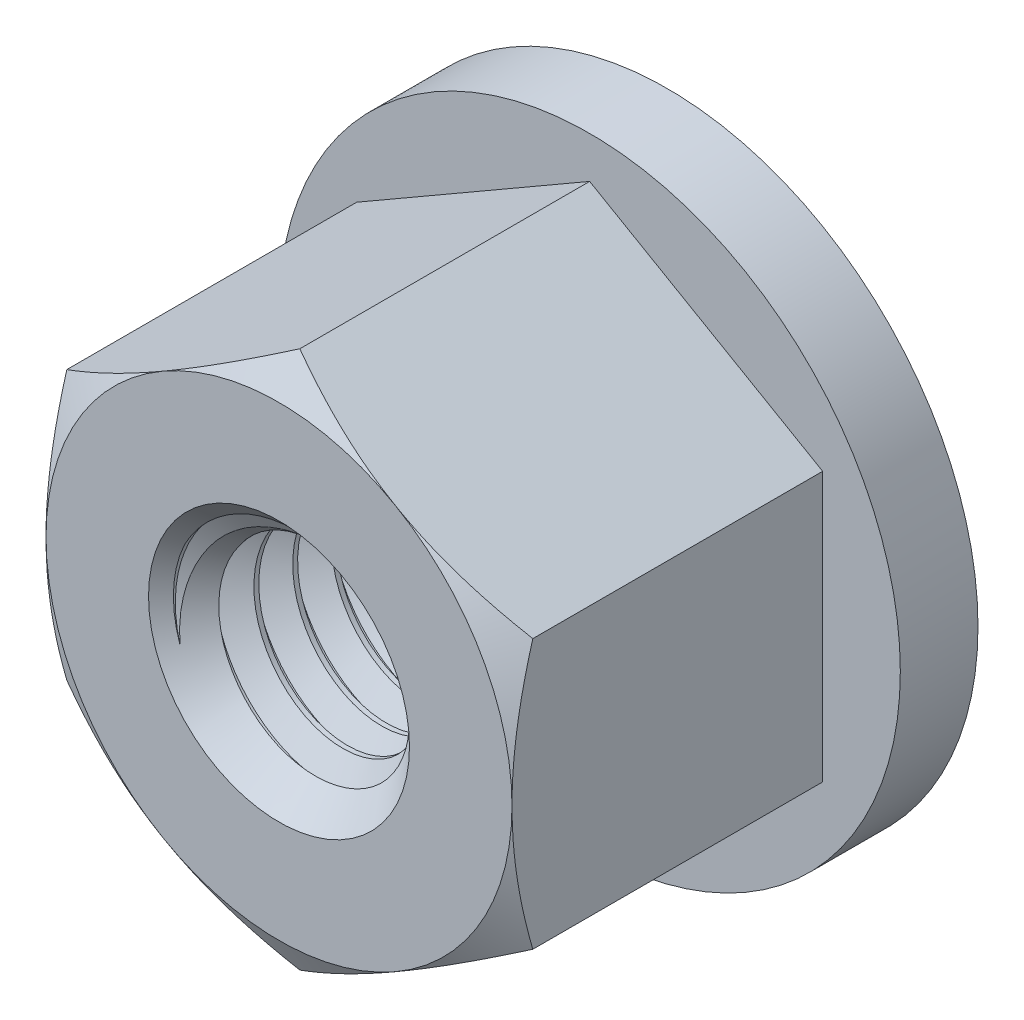
from build123d import *

# Parameters (mm, degrees)
EXTRUDE1_DEPTH     = 7.9375
SKETCH13_R         = 6.35
EXTRUDE3_DEPTH     = 1.5875
SKETCH2_OUTSIDE_W  = 63.61
SKETCH2_OUTSIDE_H  = 63.61
SKETCH2_OUTSIDE_R  = 4.7625
CUT_EXTRUDE1_DEPTH = 12.985362166
CUT_EXTRUDE1_DRAFT = -60
SKETCH4_R          = 2.413
CUT_EXTRUDE3_DEPTH = 12.985362166
SKETCH12_R         = 2.413
SKETCH12_R_2       = 1.897444252
EXTRUDE2_DEPTH     = 7.9375
CUT_SWEEP1_PITCH   = 0.79375


with BuildPart() as part:
    # Sketch1 → Extrude1 (new body)
    with BuildSketch(Plane.XY):
        Polygon((0, 5.499261314), (-4.7625, 2.749630657), (-4.7625, -2.749630657), (0, -5.499261314), (4.7625, -2.749630657), (4.7625, 2.749630657), align=None)
    extrude(amount=-EXTRUDE1_DEPTH)

    # Sketch13 → Extrude3 (add)
    with BuildSketch(Plane(origin=(0, 0, -7.9375), x_dir=(-1, 0, 0), z_dir=(0, 0, -1))):
        Circle(SKETCH13_R)
    extrude(amount=-EXTRUDE3_DEPTH)


with BuildPart() as cut_extrude1_tool:
    # Sketch2 outside → Cut-Extrude1 (with draft: the straight prism first)
    with BuildSketch(Plane.XY):
        Rectangle(SKETCH2_OUTSIDE_W, SKETCH2_OUTSIDE_H)
        Circle(SKETCH2_OUTSIDE_R, mode=Mode.SUBTRACT)
    extrude(amount=-CUT_EXTRUDE1_DEPTH)
    # Cut-Extrude1: the draft: its side faces are tilted about the plane it starts from
    cut_extrude1_sides = [cut_extrude1_tool.faces().sort_by_distance(p)[0] for p in [
        (0, -31.805, -6.492681083),
        (31.805, 0, -6.492681083),
        (0, 31.805, -6.492681083),
        (-31.805, 0, -6.492681083),
        (-4.7625, 0, -6.492681083),
    ]]
    draft(cut_extrude1_sides, Plane.XY, CUT_EXTRUDE1_DRAFT)


with BuildPart() as part_1:
    add(part.part)

    # Cut-Extrude1: cut by cut_extrude1_tool
    add(cut_extrude1_tool.part, mode=Mode.SUBTRACT)

    # Sketch4 → Cut-Extrude3 (cut, through all)
    with BuildSketch(Plane.XY):
        Circle(SKETCH4_R)
    extrude(amount=-CUT_EXTRUDE3_DEPTH, mode=Mode.SUBTRACT)

    # Sketch12 → Extrude2 (add)
    with BuildSketch(Plane.XY):
        Circle(SKETCH12_R)
        Circle(SKETCH12_R_2, mode=Mode.SUBTRACT)
    extrude(amount=-EXTRUDE2_DEPTH)

    # Cut-Sweep1: the profile of Sketch9 profile screwed along a right-hand helix of 11 turns, 6 arcs to a turn; built about Z, then put on its axis
    cut_sweep1_z = Axis((0, 0, 0), (0, 0, 1))
    cut_sweep1_corners = [(2.413, 0, -0.396875), (2.413, 0, -0.29765625), (1.897144252, 0, 0.000173205), (1.897144252, 0, -0.694704455)]
    with BuildLine(mode=Mode.PRIVATE) as cut_sweep1_profile:
        Line(cut_sweep1_corners[0], cut_sweep1_corners[1])
        Line(cut_sweep1_corners[1], cut_sweep1_corners[2])
        Line(cut_sweep1_corners[2], cut_sweep1_corners[3])
        Line(cut_sweep1_corners[3], cut_sweep1_corners[0])
    cut_sweep1_cap = Face(cut_sweep1_profile.wire())
    cut_sweep1_turn_angles = [0, 30, 60, 90, 120, 150, 180, 210, 240, 270, 300, 330, 360]
    cut_sweep1_turn_weights = [1, 0.8660254037844387, 1, 0.8660254037844387, 1, 0.8660254037844387, 1, 0.8660254037844387, 1, 0.8660254037844387, 1, 0.8660254037844387, 1]
    cut_sweep1_turn_rails = [Edge.make_bspline([Vector(p[0], p[1], 0).rotate(cut_sweep1_z, cut_sweep1_turn_angles[k]) / cut_sweep1_turn_weights[k] + Vector(0, 0, p[2] + CUT_SWEEP1_PITCH * cut_sweep1_turn_angles[k] / 360) for k in range(13)], [0, 0, 0, 1, 1, 2, 2, 3, 3, 4, 4, 5, 5, 6, 6, 6], 2, cut_sweep1_turn_weights) for p in cut_sweep1_corners]
    cut_sweep1_turn_sides = [Face.make_surface_from_curves(cut_sweep1_turn_rails[p[0]], cut_sweep1_turn_rails[p[1]]) for p in [(0, 1), (1, 2), (2, 3), (3, 0)]]
    cut_sweep1 = Plane(origin=(0, 0, 0), x_dir=(0, 1, 0), z_dir=(0, 0, -1)) * Solid(Shell([*[p.moved(Location((0, 0, CUT_SWEEP1_PITCH * i))) for i in range(11) for p in cut_sweep1_turn_sides], cut_sweep1_cap, cut_sweep1_cap.rotate(cut_sweep1_z, 3960).moved(Location((0, 0, CUT_SWEEP1_PITCH * 3960 / 360)))]))
    add(cut_sweep1, mode=Mode.SUBTRACT)

    # Cut-Extrude6 cone 1 section (through the dimple's axis) → Cut-Extrude6 (revolve, cut)
    with BuildSketch(Plane(origin=(0, 0, 0), x_dir=(0, -1, 0), z_dir=(1, 0, 0))):
        Polygon((0, 0), (2.667, 0), (0, 2.667), align=None)
    revolve(axis=Axis((0, 0, 0), (0, 0, -1)), mode=Mode.SUBTRACT)

    # Cut-Extrude7 cone 1 section (through the dimple's axis) → Cut-Extrude7 (revolve, cut)
    with BuildSketch(Plane(origin=(0, 0, -7.9375), x_dir=(0, 1, 0), z_dir=(1, 0, 0))):
        Polygon((0, 0), (2.667, 0), (0, 2.667), align=None)
    revolve(axis=Axis((0, 0, -7.9375), (0, 0, 1)), mode=Mode.SUBTRACT)


solid = part_1.part
